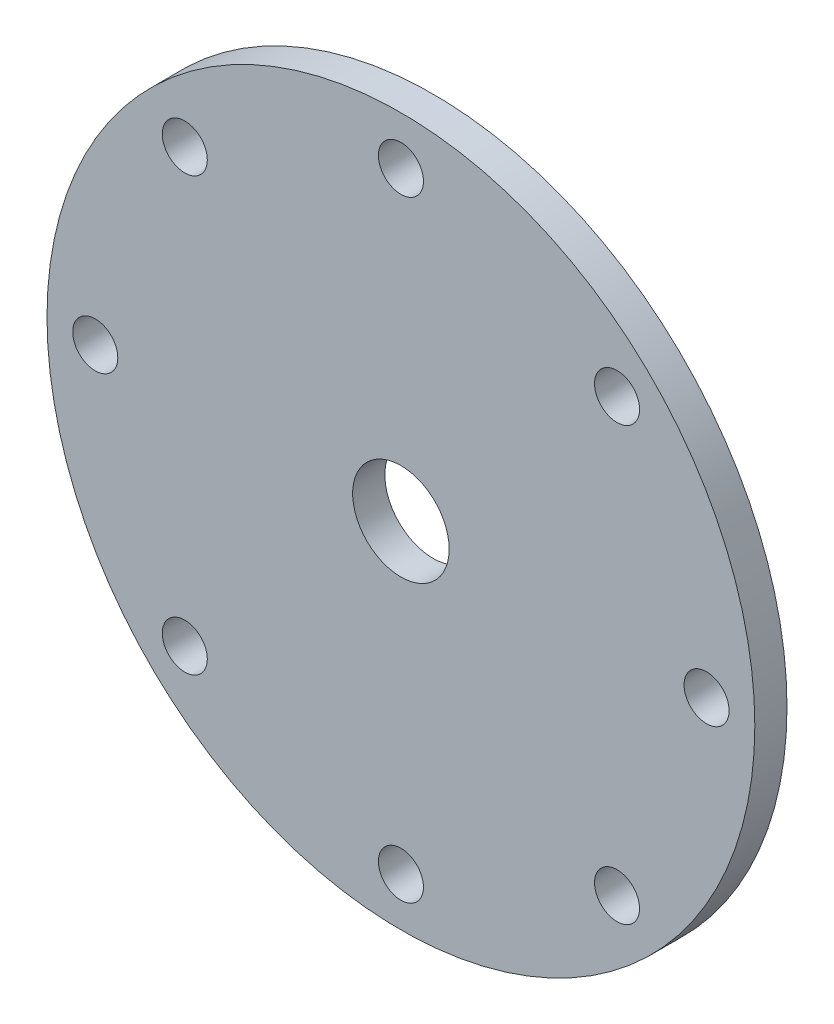
from build123d import *

# Parameters (mm, degrees)
SKETCH1_R        = 55
SKETCH1_R_2      = 3.5
SKETCH1_R_3      = 7.5
ROTOR_DISC_DEPTH = 5


with BuildPart() as part:
    # Sketch1 → Rotor Disc (new body)
    with BuildSketch(Plane.XY):
        Circle(SKETCH1_R)
        with Locations((-33.587572106, -33.587572106)):
            Circle(SKETCH1_R_2, mode=Mode.SUBTRACT)
        with Locations((-47.5, 0)):
            Circle(SKETCH1_R_2, mode=Mode.SUBTRACT)
        with Locations((0, -47.5)):
            Circle(SKETCH1_R_2, mode=Mode.SUBTRACT)
        with Locations((33.587572106, -33.587572106)):
            Circle(SKETCH1_R_2, mode=Mode.SUBTRACT)
        with Locations((-33.587572106, 33.587572106)):
            Circle(SKETCH1_R_2, mode=Mode.SUBTRACT)
        Circle(SKETCH1_R_3, mode=Mode.SUBTRACT)
        with Locations((47.5, 0)):
            Circle(SKETCH1_R_2, mode=Mode.SUBTRACT)
        with Locations((0, 47.5)):
            Circle(SKETCH1_R_2, mode=Mode.SUBTRACT)
        with Locations((33.587572106, 33.587572106)):
            Circle(SKETCH1_R_2, mode=Mode.SUBTRACT)
    extrude(amount=ROTOR_DISC_DEPTH)


solid = part.part
